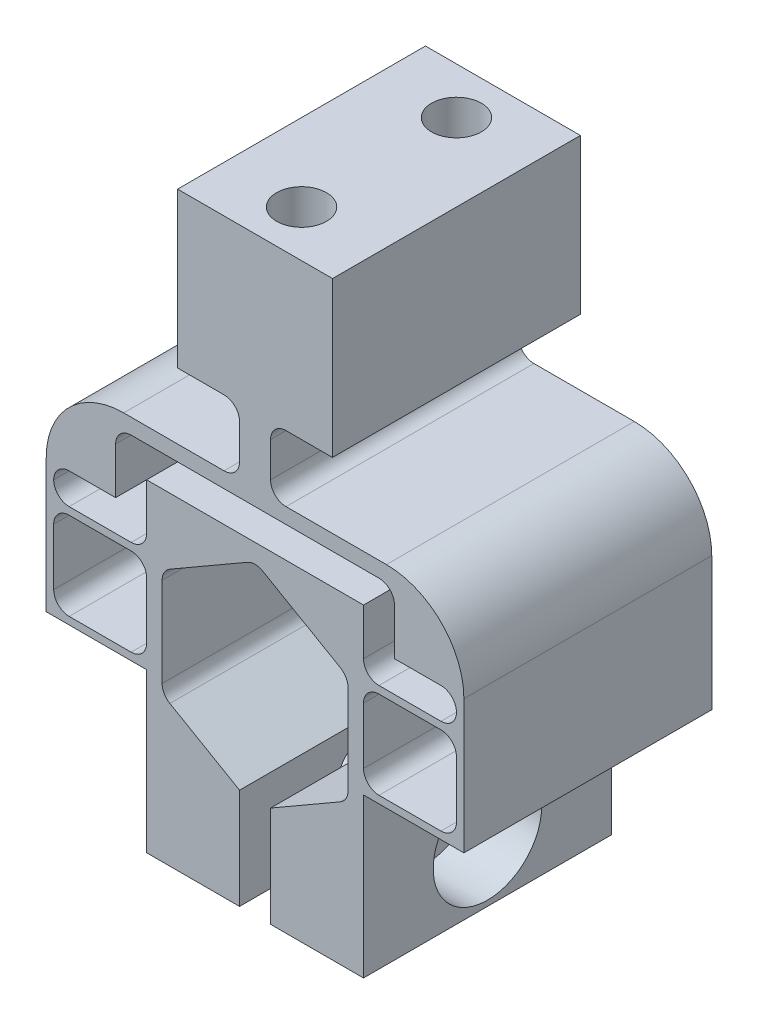
from build123d import *

# Parameters (mm, degrees)
SKETCH1_W                                        = 22.225
SKETCH1_H                                        = 25.4
EXTRUDE1_DEPTH                                   = 12.7
SKETCH2_W                                        = 9.525
SKETCH2_H                                        = 0.762
EXTRUDE2_DEPTH                                   = 25.4
SKETCH3_W                                        = 0.762
SKETCH3_H                                        = 13.678822609
EXTRUDE3_DEPTH                                   = 25.4
EXTRUDE4_DEPTH                                   = 25.4
SKETCH7_W                                        = 3.175
SKETCH7_H                                        = 25.4
EXTRUDE5_DEPTH                                   = 6.74624
SKETCH8_W                                        = 15.875
SKETCH8_H                                        = 15.875
EXTRUDE6_DEPTH                                   = 25.4
F_1_4_20_TAPPED_HOLE1_D                          = 5.1054
F_1_4_20_TAPPED_HOLE1_DEPTH                      = 9.525
F_1_4_20_TAPPED_HOLE1_TIP                        = 1.533816902
EXTRUDE7_DEPTH                                   = 53.055785583
SKETCH10_W                                       = 9.525
SKETCH10_H                                       = 7.700729076
EXTRUDE8_DEPTH                                   = 25.4
CBORE_FOR_1_4_SOCKET_HEAD_CAP_SCREW1_D           = 6.7564
CBORE_FOR_1_4_SOCKET_HEAD_CAP_SCREW1_DEPTH       = 9.525
CBORE_FOR_1_4_SOCKET_HEAD_CAP_SCREW1_CBORE_D     = 11.1125
CBORE_FOR_1_4_SOCKET_HEAD_CAP_SCREW1_CBORE_DEPTH = 6.35
F_1_4_20_TAPPED_HOLE2_D                          = 5.1054
FILLET1_R                                        = 1.5875
FILLET2_R                                        = 7.9375


with BuildPart() as part:
    # Sketch1 → Extrude1 (new, symmetric)
    with BuildSketch(Plane.XY):
        Rectangle(SKETCH1_W, SKETCH1_H)
        Polygon((0, 10.998522628), (-9.525, 5.499261314), (-9.525, -5.499261314), (0, -10.998522628), (9.525, -5.499261314), (9.525, 5.499261314), align=None, mode=Mode.SUBTRACT)
    extrude(amount=EXTRUDE1_DEPTH, both=True)

    # Sketch2 → Extrude2 (add)
    with BuildSketch(Plane.XY.offset(12.7)):
        with Locations((15.875, 5.969)):
            Rectangle(SKETCH2_W, SKETCH2_H)
        with Locations((15.875, -3.772822609)):
            Rectangle(SKETCH2_W, SKETCH2_H)
        with Locations((-15.875, -3.772822609)):
            Rectangle(SKETCH2_W, SKETCH2_H)
        with Locations((-15.875, 5.969)):
            Rectangle(SKETCH2_W, SKETCH2_H)
    extrude(amount=-EXTRUDE2_DEPTH)

    # Sketch3 → Extrude3 (add)
    with BuildSketch(Plane.XY.offset(12.7)):
        with Locations((21.0185, 2.685588695)):
            Rectangle(SKETCH3_W, SKETCH3_H)
        with Locations((-21.0185, 2.685588695)):
            Rectangle(SKETCH3_W, SKETCH3_H)
    extrude(amount=-EXTRUDE3_DEPTH)

    # Sketch4 → Extrude4 (add)
    with BuildSketch(Plane.XY.offset(12.7)):
        Polygon((-21.3995, 17.4625), (21.3995, 17.4625), (21.3995, 9.525), (14.2875, 9.525), (14.2875, 15.875), (-14.2875, 15.875), (-14.2875, 9.525), (-21.3995, 9.525), align=None)
    extrude(amount=-EXTRUDE4_DEPTH)

    # Sketch7 → Extrude5 (add)
    with BuildSketch(Plane(origin=(0, 17.4625, 0), x_dir=(1, 0, 0), z_dir=(0, 1, 0))):
        Rectangle(SKETCH7_W, SKETCH7_H)
    extrude(amount=EXTRUDE5_DEPTH)

    # Sketch8 → Extrude6 (add)
    with BuildSketch(Plane.XY.offset(12.7)):
        with Locations((0, 32.14624)):
            Rectangle(SKETCH8_W, SKETCH8_H)
    extrude(amount=-EXTRUDE6_DEPTH)

    # 1/4-20 Tapped Hole1
    with Locations(Plane(origin=(-10.978640872, 40.08374, -1.669383244), x_dir=(-1, 0, 0), z_dir=(0, 1, 0))):
        with Locations((-10.978640872, -6.268116756), (-10.978640872, 9.606883244)):
            Hole(F_1_4_20_TAPPED_HOLE1_D / 2, depth=F_1_4_20_TAPPED_HOLE1_DEPTH)
            with Locations((0, 0, -(F_1_4_20_TAPPED_HOLE1_DEPTH + F_1_4_20_TAPPED_HOLE1_TIP / 2))):  # 118° drill point
                Cone(0, F_1_4_20_TAPPED_HOLE1_D / 2, F_1_4_20_TAPPED_HOLE1_TIP, mode=Mode.SUBTRACT)

    # Sketch9 → Extrude7 (cut, through all)
    with BuildSketch(Plane.XY.offset(12.7)):
        Polygon((-1.5875, -10.081979076), (-1.5875, -12.7), (1.5875, -12.7), (1.5875, -10.081979076), (0, -10.998522628), align=None)
    extrude(amount=-EXTRUDE7_DEPTH, mode=Mode.SUBTRACT)

    # Sketch10 → Extrude8 (add)
    with BuildSketch(Plane.XY.offset(12.7)):
        with Locations((6.35, -16.550364538)):
            Rectangle(SKETCH10_W, SKETCH10_H)
        with Locations((-6.35, -16.550364538)):
            Rectangle(SKETCH10_W, SKETCH10_H)
    extrude(amount=-EXTRUDE8_DEPTH)

    # CBORE for 1/4 Socket Head Cap Screw1
    with Locations(Plane(origin=(11.1125, 0, 0), x_dir=(0, 0, -1), z_dir=(1, 0, 0))):
        with Locations((0, -14.2875)):
            CounterBoreHole(CBORE_FOR_1_4_SOCKET_HEAD_CAP_SCREW1_D / 2, CBORE_FOR_1_4_SOCKET_HEAD_CAP_SCREW1_CBORE_D / 2, CBORE_FOR_1_4_SOCKET_HEAD_CAP_SCREW1_CBORE_DEPTH, depth=CBORE_FOR_1_4_SOCKET_HEAD_CAP_SCREW1_DEPTH)

    # 1/4-20 Tapped Hole2 (through all)
    with Locations(Plane.ZY.offset(11.1125)):
        with Locations((0, -14.2875)):
            Hole(F_1_4_20_TAPPED_HOLE2_D / 2)

    # Fillet1
    fillet1_edges = [part.edges().sort_by_distance(p)[0] for p in [
        (-1.5875, 17.4625, 0),
        (1.5875, 17.4625, 0),
        (1.5875, 24.20874, 0),
        (-1.5875, 24.20874, 0),
        (11.1125, 5.588, 0),
        (20.6375, -3.391822609, 0),
        (-11.1125, -3.391822609, 0),
        (-11.1125, 5.588, 0),
        (20.6375, 5.588, 0),
        (11.1125, -3.391822609, 0),
        (-20.6375, -3.391822609, 0),
        (-20.6375, 6.35, 0),
        (-20.6375, 9.525, 0),
        (-20.6375, 5.588, 0),
        (9.525, -5.499261314, 0),
        (9.525, 5.499261314, 0),
        (0, 10.998522628, 0),
        (-9.525, 5.499261314, 0),
        (-9.525, -5.499261314, 0),
        (-11.1125, 6.35, 0),
        (-14.2875, 15.875, 0),
        (14.2875, 15.875, 0),
        (20.6375, 6.35, 0),
        (20.6375, 9.525, 0),
        (11.1125, 6.35, 0),
    ]]
    fillet(fillet1_edges, radius=FILLET1_R - 0.0001)  # a hair under: the kernel refuses the full size

    # Fillet2
    fillet2_edges = [part.edges().sort_by_distance(p)[0] for p in [
        (21.3995, 17.4625, 0),
        (-21.3995, 17.4625, 0),
    ]]
    fillet(fillet2_edges, radius=FILLET2_R)


solid = part.part
